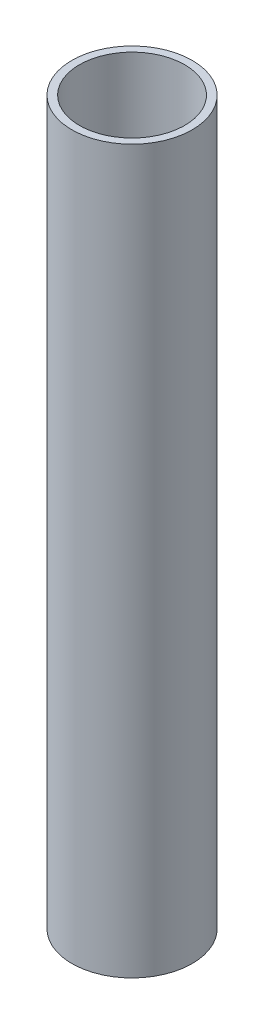
from build123d import *

# Parameters (mm, degrees)
SKETCH1_R           = 25.4
SKETCH1_R_2         = 22.225
BOSS_EXTRUDE1_DEPTH = 304.8


with BuildPart() as part:
    # Sketch1 → Boss-Extrude1 (new body)
    with BuildSketch(Plane(origin=(0, 0, 0), x_dir=(1, 0, 0), z_dir=(0, 1, 0))):
        Circle(SKETCH1_R)
        Circle(SKETCH1_R_2, mode=Mode.SUBTRACT)
    extrude(amount=BOSS_EXTRUDE1_DEPTH)


solid = part.part
